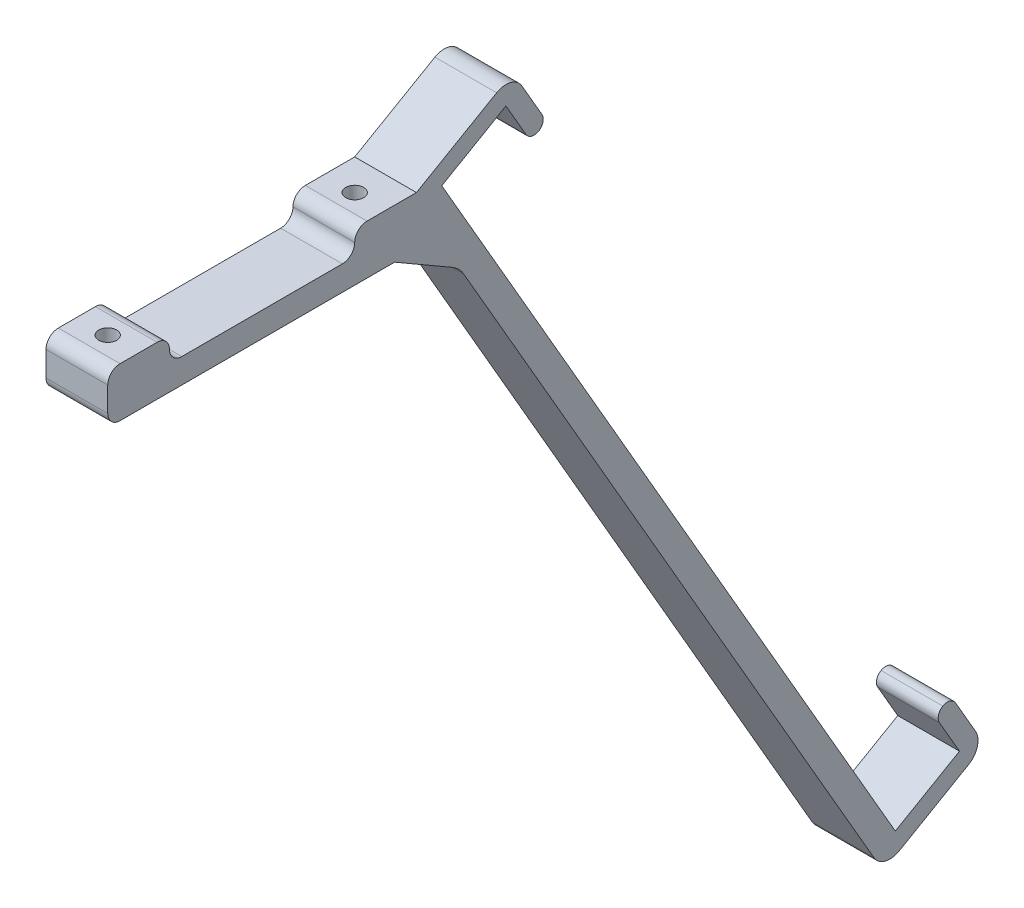
from build123d import *

# Parameters (mm, degrees)
EXTRUDE_1_DEPTH     = 10
SKETCH_4_W          = 10
SKETCH_4_H          = 4
EXTRUDE_2_DEPTH     = 10
CUT_EXTRUDE_1_REACH = 164.425
SKETCH_2_R          = 1.45
FILLET_1_R          = 2
EXTRUDE_3_DEPTH     = 10
FILLET_5_R          = 1.5
EXTRUDE_4_DEPTH     = 10
CUT_EXTRUDE_3_REACH = 174.593
FILLET_3_R          = 3
CHAMFER_1_SIZE      = 7
FILLET_7_R          = 5


with BuildPart() as part:
    # 草图1 → 拉伸-薄壁1 (new body)
    with BuildSketch(Plane(origin=(0, 0, 0), x_dir=(0, 0, -1), z_dir=(1, 0, 0))):
        Polygon((98, -126.439708953), (25, 0), (-25, 0), (-25, 4), (27.309401077, 4), (101.464101615, -124.439708953), align=None)
    extrude(amount=EXTRUDE_1_DEPTH)

    # 草图4 → 凸台-拉伸2 (add)
    with BuildSketch(Plane(origin=(10, 0, 0), x_dir=(0, 0, -1), z_dir=(1, 0, 0))):
        Polygon((27.309401077, 4), (25, 8), (15, 8), (15, 4), align=None)
        with Locations((-20, 6)):
            Rectangle(SKETCH_4_W, SKETCH_4_H)
    extrude(amount=-EXTRUDE_2_DEPTH)

    # 草图2 → 切除-拉伸1 (cut, up to next)
    with BuildSketch(Plane.XZ, mode=Mode.PRIVATE) as cut_extrude_1_sk1:
        with Locations(Location((5, 20, 0), (0, 0, 270))):
            Circle(SKETCH_2_R)
    cut_extrude_1_tool1 = extrude(cut_extrude_1_sk1.sketch, amount=-CUT_EXTRUDE_1_REACH, mode=Mode.PRIVATE) & part.part
    # 草图2 → 切除-拉伸1 (cut, up to next)
    with BuildSketch(Plane.XZ, mode=Mode.PRIVATE) as cut_extrude_1_sk2:
        with Locations(Location((5, -20, 0), (0, 0, 270))):
            Circle(SKETCH_2_R)
    cut_extrude_1_tool2 = extrude(cut_extrude_1_sk2.sketch, amount=-CUT_EXTRUDE_1_REACH, mode=Mode.PRIVATE) & part.part
    add(cut_extrude_1_tool1.solids().sort_by_distance((5, 0, 20))[0], mode=Mode.SUBTRACT)
    add(cut_extrude_1_tool2.solids().sort_by_distance((5, 0, -20))[0], mode=Mode.SUBTRACT)

    # 圆角1
    fillet_1_edges = [part.edges().sort_by_distance(p)[0] for p in [
        (5, 8, 25),
        (5, 4, 15),
        (5, 8, 15),
        (5, 4, -15),
        (5, 8, -15),
        (5, 0, 25),
    ]]
    fillet(fillet_1_edges, radius=FILLET_1_R - 0.0001)  # a hair under: the kernel refuses the full size

    # 草图6 → 凸台-拉伸3 (add)
    with BuildSketch(Plane(origin=(10, 0, 0), x_dir=(0, 0, -1), z_dir=(1, 0, 0))):
        Polygon((25, 8), (40.588457268, 17), (46.088457268, 7.473720558), (43.490381057, 5.973720558), (39.490381057, 12.901923789), (26.5, 5.401923789), align=None)
        Polygon((99.964101615, -121.841632741), (101.464101615, -124.439708953), (117.052558883, -115.439708953), (111.552558883, -105.913429511), (108.954482672, -107.413429511), (112.954482672, -114.341632741), align=None)
    extrude(amount=-EXTRUDE_3_DEPTH)

    # 圆角5
    fillet_5_edges = [part.edges().sort_by_distance(p)[0] for p in [
        (5, -107.413429511, -108.954482672),
        (5, -105.913429511, -111.552558883),
        (5, 5.973720558, -43.490381057),
        (5, 7.473720558, -46.088457268),
    ]]
    fillet(fillet_5_edges, radius=FILLET_5_R - 0.0001)  # a hair under: the kernel refuses the full size

    # 草图7 → 凸台-拉伸4 (add)
    with BuildSketch(Plane(origin=(10, 0, 0), x_dir=(0, 0, -1), z_dir=(1, 0, 0))):
        Polygon((26.5, 5.401923789), (99.964101615, -121.841632741), (102.562177826, -120.341632741), (29.098076211, 6.901923789), align=None)
    extrude(amount=-EXTRUDE_4_DEPTH)

    # 草图8 → 切除-拉伸3 (cut, up to next)
    with BuildSketch(Plane(origin=(10, 0, 0), x_dir=(0, 0, -1), z_dir=(1, 0, 0)), mode=Mode.PRIVATE) as cut_extrude_3_sk1:
        Polygon((25, 0), (98, -126.439708953), (100.598076211, -124.939708953), (28.464101615, 0), align=None)
    cut_extrude_3_tool1 = extrude(cut_extrude_3_sk1.sketch, amount=-CUT_EXTRUDE_3_REACH, mode=Mode.PRIVATE) & part.part
    add(cut_extrude_3_tool1.solids().sort_by_distance((10, -62.8456, -63.01253))[0], mode=Mode.SUBTRACT)

    # 圆角3
    fillet_3_edges = [part.edges().sort_by_distance(p)[0] for p in [
        (5, -115.439708953, -117.052558883),
        (5, -124.939708953, -100.598076211),
        (5, 17, -40.588457268),
    ]]
    fillet(fillet_3_edges, radius=FILLET_3_R)

    # 倒角1
    chamfer_1_edges = [part.edges().sort_by_distance(p)[0] for p in [
        (5, 0, -28.464101615),
    ]]
    chamfer(chamfer_1_edges, length=CHAMFER_1_SIZE)

    # 圆角7
    fillet_7_edges = [part.edges().sort_by_distance(p)[0] for p in [
        (5, -6.062177826, -31.964101615),
    ]]
    fillet(fillet_7_edges, radius=FILLET_7_R)


solid = part.part
